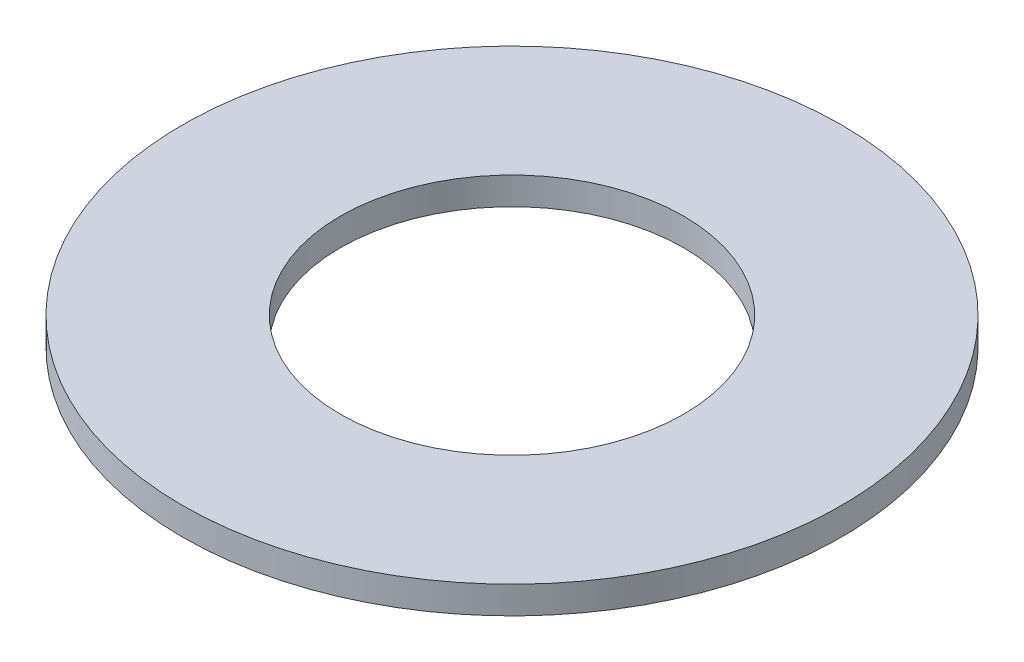
from build123d import *

# Parameters (mm, degrees)
SKETCH1_R          = 12
SKETCH1_R_2        = 6.25
BASE_FLANGE1_DEPTH = 1


# Sheet-metal steps are written as plain solids
with BuildPart() as part:
    # Sketch1 → Base-Flange1 (new body)
    with BuildSketch(Plane(origin=(0, 0, 0), x_dir=(1, 0, 0), z_dir=(0, 1, 0))):
        with Locations(Location((0, 0, 0), (0, 0, 270))):
            Circle(SKETCH1_R)
        with Locations(Location((0, 0, 0), (0, 0, 270))):
            Circle(SKETCH1_R_2, mode=Mode.SUBTRACT)
    extrude(amount=-BASE_FLANGE1_DEPTH)


solid = part.part
